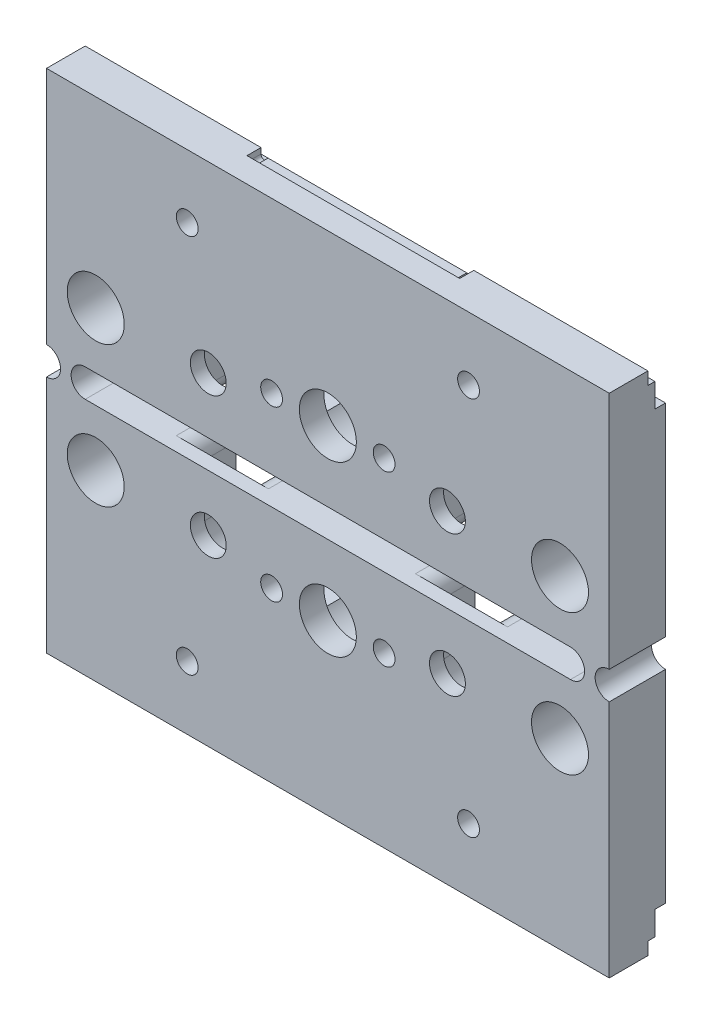
from build123d import *

# Parameters (mm, degrees)
SKETCH_2_W           = 80
SKETCH_2_H           = 34
SKETCH_2_R           = 4.05
EXTRUDE_1_DEPTH      = 8
SKETCH_3_R           = 2.55
CUT_EXTRUDE_1_DEPTH  = 88.292611371
CUT_EXTRUDE_2_DEPTH  = 88.292611371
SKETCH_5_R           = 1.55
CUT_EXTRUDE_3_DEPTH  = 88.292611371
CUT_EXTRUDE_4_DEPTH  = 6
CUT_EXTRUDE_5_DEPTH  = 4.5
SKETCH_20_R          = 5.5
CUT_EXTRUDE_12_DEPTH = 4.5
SKETCH_25_R          = 1.55
CUT_EXTRUDE_13_DEPTH = 88.292611371
CUT_EXTRUDE_11_DEPTH = 2
EXTRUDE_2_DEPTH      = 8


with BuildPart() as part:
    # 草图2 → 凸台-拉伸1 (new body)
    with BuildSketch(Plane.XY):
        with Locations((40, 17)):
            Rectangle(SKETCH_2_W, SKETCH_2_H)
        with Locations((7, 8)):
            Circle(SKETCH_2_R, mode=Mode.SUBTRACT)
        with Locations((40, 10)):
            Circle(SKETCH_2_R, mode=Mode.SUBTRACT)
        with Locations((73, 8)):
            Circle(SKETCH_2_R, mode=Mode.SUBTRACT)
    extrude_1 = extrude(amount=EXTRUDE_1_DEPTH)

    # 草图3 → 切除-拉伸1 (cut, through all)
    with BuildSketch(Plane.XY.offset(8)):
        with Locations((23, 8)):
            Circle(SKETCH_3_R)
        with Locations((57, 8)):
            Circle(SKETCH_3_R)
    cut_extrude_1 = extrude(amount=-CUT_EXTRUDE_1_DEPTH, mode=Mode.SUBTRACT)

    # 草图4 → 切除-拉伸2 (cut, through all)
    with BuildSketch(Plane(origin=(80, 0, 0), x_dir=(0, 0, -1), z_dir=(1, 0, 0))):
        Polygon((-1.5, 32.2), (-2.5, 32.2), (-2.5, 34), (0, 34), (0, 28.8), (-1.5, 28.8), align=None)
    cut_extrude_2 = extrude(amount=-CUT_EXTRUDE_2_DEPTH, mode=Mode.SUBTRACT)

    # 草图5 → 切除-拉伸3 (cut, through all)
    with BuildSketch(Plane.XY.offset(8)):
        with Locations((48, 10)):
            Circle(SKETCH_5_R)
        with Locations((32, 10)):
            Circle(SKETCH_5_R)
    cut_extrude_3 = extrude(amount=-CUT_EXTRUDE_3_DEPTH, mode=Mode.SUBTRACT)

    # 草图7 → 切除-拉伸4 (cut)
    with BuildSketch(Plane(origin=(0, 0, 0), x_dir=(-1, 0, 0), z_dir=(0, 0, -1))):
        with BuildLine():
            Line((-27.05, 10), (-27.05, 2.5))
            ThreePointArc((-27.05, 2.5), (-27.782233047, 0.732233047), (-29.55, 0))
            Line((-29.55, 0), (-16.45, 0))
            ThreePointArc((-16.45, 0), (-18.217766953, 0.732233047), (-18.95, 2.5))
            Line((-18.95, 2.5), (-18.95, 10))
            ThreePointArc((-18.95, 10), (-23, 14.05), (-27.05, 10))
        make_face()
        with BuildLine():
            Line((-61.05, 2.5), (-61.05, 10))
            ThreePointArc((-61.05, 10), (-57, 14.05), (-52.95, 10))
            Line((-52.95, 10), (-52.95, 2.5))
            ThreePointArc((-52.95, 2.5), (-52.217766953, 0.732233047), (-50.45, 0))
            Line((-50.45, 0), (-63.55, 0))
            ThreePointArc((-63.55, 0), (-61.782233047, 0.732233047), (-61.05, 2.5))
        make_face()
    cut_extrude_4 = extrude(amount=-CUT_EXTRUDE_4_DEPTH, mode=Mode.SUBTRACT)

    # 草图8 → 切除-拉伸5 (cut)
    with BuildSketch(Plane(origin=(0, 0, 0), x_dir=(-1, 0, 0), z_dir=(0, 0, -1))):
        with BuildLine():
            Line((-30.5, 12.85), (-49.5, 12.85))
            ThreePointArc((-49.5, 12.85), (-52.35, 10), (-49.5, 7.15))
            Line((-49.5, 7.15), (-30.5, 7.15))
            ThreePointArc((-30.5, 7.15), (-27.65, 10), (-30.5, 12.85))
        make_face()
    cut_extrude_5 = extrude(amount=-CUT_EXTRUDE_5_DEPTH, mode=Mode.SUBTRACT)

    # 草图20 → 切除-拉伸12 (cut)
    with BuildSketch(Plane(origin=(0, 0, 0), x_dir=(-1, 0, 0), z_dir=(0, 0, -1))):
        with Locations((-40, 10)):
            Circle(SKETCH_20_R)
    cut_extrude_12 = extrude(amount=-CUT_EXTRUDE_12_DEPTH, mode=Mode.SUBTRACT)

    # 草图25 → 切除-拉伸13 (cut, through all)
    with BuildSketch(Plane(origin=(0, 0, 0), x_dir=(-1, 0, 0), z_dir=(0, 0, -1))):
        with Locations((-60, 25)):
            Circle(SKETCH_25_R)
        with Locations((-20, 25)):
            Circle(SKETCH_25_R)
    cut_extrude_13 = extrude(amount=-CUT_EXTRUDE_13_DEPTH, mode=Mode.SUBTRACT)

    # 草图19 → 切除-拉伸11 (cut)
    with BuildSketch(Plane(origin=(0, 0, 2.5), x_dir=(-1, 0, 0), z_dir=(0, 0, -1))):
        with BuildLine():
            Line((-25, 34), (-55.247938178, 34))
            Line((-55.247938178, 34), (-55.247938178, 33.2))
            ThreePointArc((-55.247938178, 33.2), (-54.747938178, 32.7), (-54.247938178, 33.2))
            Line((-54.247938178, 33.2), (-26, 33.2))
            ThreePointArc((-26, 33.2), (-25.5, 32.7), (-25, 33.2))
            Line((-25, 33.2), (-25, 34))
        make_face()
    cut_extrude_11 = extrude(amount=-CUT_EXTRUDE_11_DEPTH, mode=Mode.SUBTRACT)

    # 草图22 → 凸台-拉伸2 (add)
    with BuildSketch(Plane.XY.offset(8)):
        with BuildLine():
            Line((0, -4), (5.5, -4))
            ThreePointArc((5.5, -4), (3.5, -2), (5.5, 0))
            Line((5.5, 0), (0, 0))
            ThreePointArc((0, 0), (2, -2), (0, -4))
        make_face()
        with BuildLine():
            Line((80, 0), (74.5, 0))
            ThreePointArc((74.5, 0), (76.5, -2), (74.5, -4))
            Line((74.5, -4), (80, -4))
            ThreePointArc((80, -4), (78, -2), (80, 0))
        make_face()
    extrude(amount=-EXTRUDE_2_DEPTH)

    # 镜向2: 凸台-拉伸1, 切除-拉伸1, 切除-拉伸2, 切除-拉伸3, 切除-拉伸4, 切除-拉伸5, 切除-拉伸12, 切除-拉伸13, 切除-拉伸11 across plane
    add(extrude_1.mirror(Plane(origin=(0, -2, 0), x_dir=(0, 0, 1), z_dir=(0, -1, 0))))
    add(cut_extrude_1.mirror(Plane(origin=(0, -2, 0), x_dir=(0, 0, 1), z_dir=(0, -1, 0))), mode=Mode.SUBTRACT)
    add(cut_extrude_2.mirror(Plane(origin=(0, -2, 0), x_dir=(0, 0, 1), z_dir=(0, -1, 0))), mode=Mode.SUBTRACT)
    add(cut_extrude_3.mirror(Plane(origin=(0, -2, 0), x_dir=(0, 0, 1), z_dir=(0, -1, 0))), mode=Mode.SUBTRACT)
    add(cut_extrude_4.mirror(Plane(origin=(0, -2, 0), x_dir=(0, 0, 1), z_dir=(0, -1, 0))), mode=Mode.SUBTRACT)
    add(cut_extrude_5.mirror(Plane(origin=(0, -2, 0), x_dir=(0, 0, 1), z_dir=(0, -1, 0))), mode=Mode.SUBTRACT)
    add(cut_extrude_12.mirror(Plane(origin=(0, -2, 0), x_dir=(0, 0, 1), z_dir=(0, -1, 0))), mode=Mode.SUBTRACT)
    add(cut_extrude_13.mirror(Plane(origin=(0, -2, 0), x_dir=(0, 0, 1), z_dir=(0, -1, 0))), mode=Mode.SUBTRACT)
    add(cut_extrude_11.mirror(Plane(origin=(0, -2, 0), x_dir=(0, 0, 1), z_dir=(0, -1, 0))), mode=Mode.SUBTRACT)


solid = part.part
